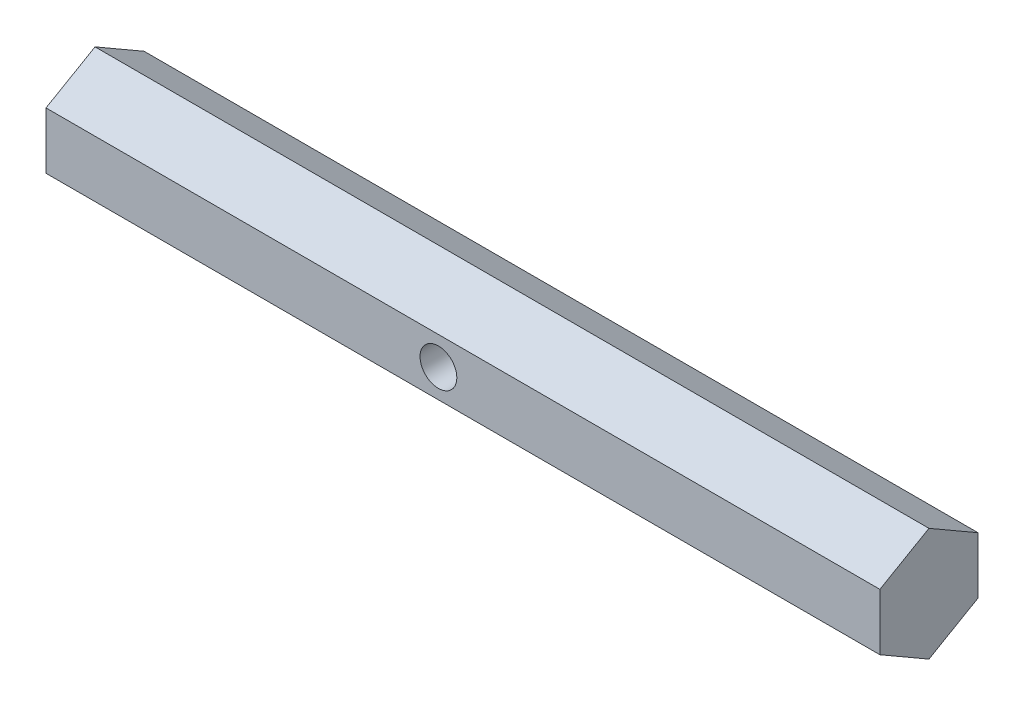
from build123d import *

# Parameters (mm, degrees)
BOSS_EXTRUDE1_DEPTH = 107.95
SKETCH2_R           = 2.38125
CUT_EXTRUDE1_DEPTH  = 109.941524835


with BuildPart() as part:
    # Sketch1 → Boss-Extrude1 (new body)
    with BuildSketch(Plane(origin=(0, 0, 0), x_dir=(0, 0, -1), z_dir=(1, 0, 0))):
        Polygon((6.35, -3.666174209), (6.35, 3.666174209), (0, 7.332348419), (-6.35, 3.666174209), (-6.35, -3.666174209), (0, -7.332348419), align=None)
    extrude(amount=BOSS_EXTRUDE1_DEPTH)

    # Sketch2 → Cut-Extrude1 (cut, through all)
    with BuildSketch(Plane.XY.offset(6.35)):
        with Locations((50.8, 0)):
            Circle(SKETCH2_R)
    extrude(amount=-CUT_EXTRUDE1_DEPTH, mode=Mode.SUBTRACT)


solid = part.part
